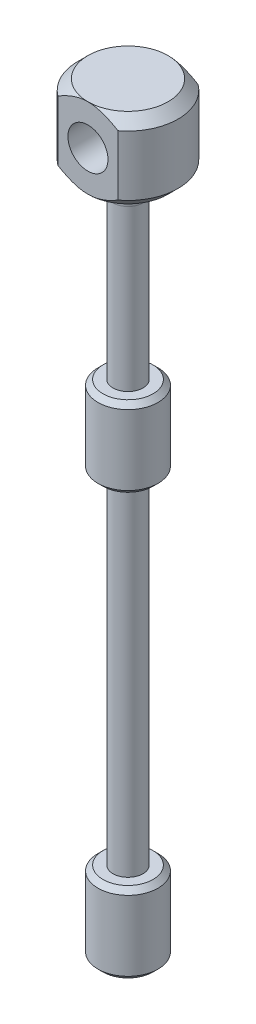
from build123d import *

# Parameters (mm, degrees)
SKETCH1_R               = 3
BOSS_EXTRUDE1_DEPTH     = 8
SKETCH2_R               = 1.5
BOSS_EXTRUDE2_DEPTH     = 34
SKETCH3_R               = 3
BOSS_EXTRUDE3_DEPTH     = 8
SKETCH4_R               = 1.5
BOSS_EXTRUDE4_DEPTH     = 18
BOSS_EXTRUDE5_DEPTH     = 8
CUT_EXTRUDE1_DEPTH      = 77.583287994
CUT_EXTRUDE1_DEPTH_BACK = 77.583287994
SKETCH6_R               = 2
CHAMFER1_SIZE           = 1
CHAMFER2_SIZE           = 0.5
FILLET1_R               = 2


with BuildPart() as part:
    # Sketch1 → Boss-Extrude1 (new body)
    with BuildSketch(Plane(origin=(0, 0, 0), x_dir=(1, 0, 0), z_dir=(0, 1, 0))):
        with Locations(Location((0, 0, 0), (0, 0, 270))):
            Circle(SKETCH1_R)
    extrude(amount=BOSS_EXTRUDE1_DEPTH)

    # Sketch2 → Boss-Extrude2 (add)
    with BuildSketch(Plane(origin=(0, 8, 0), x_dir=(1, 0, 0), z_dir=(0, 1, 0))):
        with Locations(Location((0, 0, 0), (0, 0, 270))):
            Circle(SKETCH2_R)
    extrude(amount=BOSS_EXTRUDE2_DEPTH)

    # Sketch3 → Boss-Extrude3 (add)
    with BuildSketch(Plane(origin=(0, 42, 0), x_dir=(1, 0, 0), z_dir=(0, 1, 0))):
        with Locations(Location((0, 0, 0), (0, 0, 270))):
            Circle(SKETCH3_R)
    extrude(amount=BOSS_EXTRUDE3_DEPTH)

    # Sketch4 → Boss-Extrude4 (add)
    with BuildSketch(Plane(origin=(0, 50, 0), x_dir=(1, 0, 0), z_dir=(0, 1, 0))):
        with Locations(Location((0, 0, 0), (0, 0, 270))):
            Circle(SKETCH4_R)
    extrude(amount=BOSS_EXTRUDE4_DEPTH)

    # Sketch5 → Boss-Extrude5 (add)
    with BuildSketch(Plane(origin=(0, 68, 0), x_dir=(1, 0, 0), z_dir=(0, 1, 0))):
        with BuildLine():
            Line((-3, 4), (3, 4))
            ThreePointArc((3, 4), (5, 0), (3, -4))
            Line((3, -4), (-3, -4))
            ThreePointArc((-3, -4), (-5, 0), (-3, 4))
        make_face()
    extrude(amount=BOSS_EXTRUDE5_DEPTH)

    # Sketch6 → Cut-Extrude1 (cut, two sides: drawn at the far end of the back side and taken through both)
    with BuildSketch(Plane.XY.offset(4).offset(-CUT_EXTRUDE1_DEPTH_BACK)):
        with Locations((0, 72)):
            Circle(SKETCH6_R)
    extrude(amount=CUT_EXTRUDE1_DEPTH + CUT_EXTRUDE1_DEPTH_BACK, mode=Mode.SUBTRACT)

    # Chamfer1
    chamfer1_edges = [part.edges().sort_by_distance(p)[0] for p in [
        (5, 68, 0),
        (-5, 68, 0),
        (-5, 76, 0),
        (5, 76, 0),
    ]]
    chamfer(chamfer1_edges, length=CHAMFER1_SIZE - 0.0001)  # a hair under: the kernel refuses the full size

    # Chamfer2
    chamfer2_edges = [part.edges().sort_by_distance(p)[0] for p in [
        (0, 50, -3),
        (0, 0, -3),
        (0, 8, -3),
        (0, 42, -3),
    ]]
    chamfer(chamfer2_edges, length=CHAMFER2_SIZE)

    # Fillet1
    fillet1_edges = [part.edges().sort_by_distance(p)[0] for p in [
        (0, 68, -1.5),
    ]]
    fillet(fillet1_edges, radius=FILLET1_R)


solid = part.part
